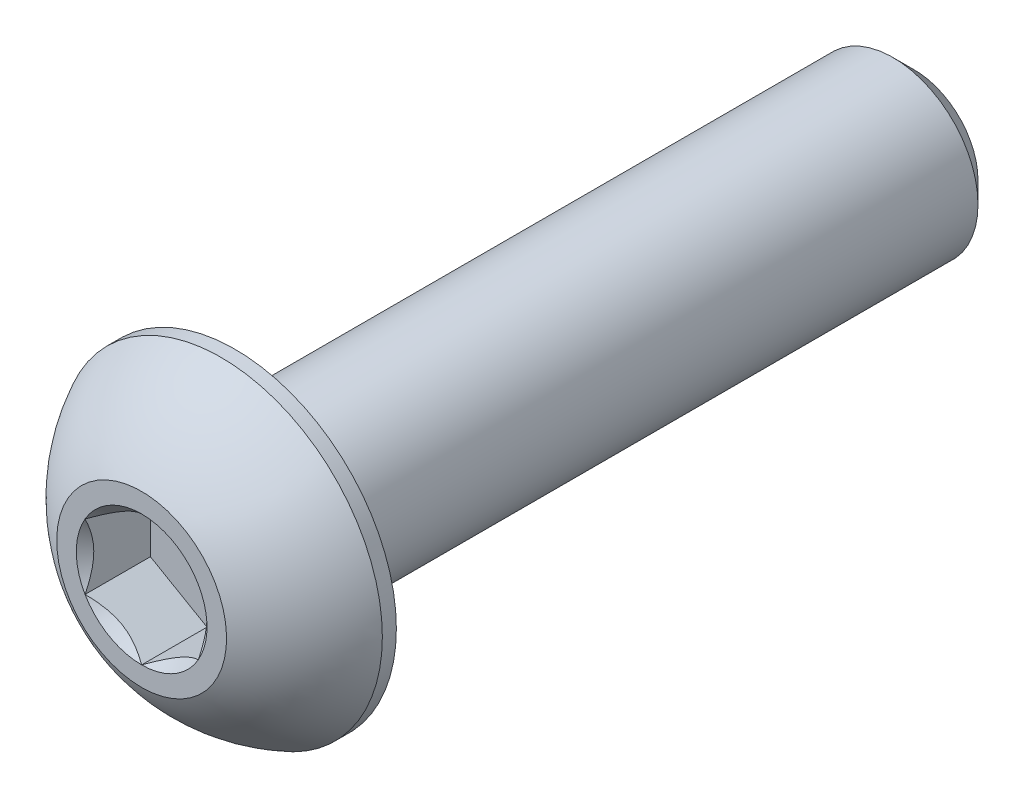
from build123d import *

# Parameters (mm, degrees)
CUT_EXTRUDE2_DEPTH = 1.155


with BuildPart() as part:
    # Sketch10 → Revolve3 (revolve)
    with BuildSketch(Plane(origin=(0, 0, 0), x_dir=(0, 0, -1), z_dir=(1, 0, 0)), mode=Mode.PRIVATE) as revolve3_sk:
        Polygon((13.275, 1.5), (13.65, 1.125), (13.65, 0), (1.65, 0), (1.65, 1.5), align=None)
    revolve(revolve3_sk.sketch.rotate(Axis((0, 0, 0), (0, 0, -1)), 90), axis=Axis((0, 0, 0), (0, 0, -1)))

    # Sketch7 → Revolve2 (revolve)
    with BuildSketch(Plane(origin=(0, 0, 0), x_dir=(0, 0, -1), z_dir=(1, 0, 0)), mode=Mode.PRIVATE) as revolve2_sk:
        with BuildLine():
            Line((1.4025, 2.85), (1.65, 2.85))
            Line((1.65, 2.85), (1.65, 0))
            Line((1.65, 0), (0, 0))
            Line((0, 0), (0, 1.5))
            ThreePointArc((0, 1.5), (0.59512511, 2.285251969), (1.4025, 2.85))
        make_face()
    revolve(revolve2_sk.sketch.rotate(Axis((0, 0, 0), (0, 0, -1)), 180), axis=Axis((0, 0, 0), (0, 0, -1)))

    # Sketch5 → Cut-Extrude2 (cut)
    with BuildSketch(Plane.XY):
        Polygon((1, -0.577350269), (1, 0.577350269), (0, 1.154700538), (-1, 0.577350269), (-1, -0.577350269), (0, -1.154700538), align=None)
    extrude(amount=-CUT_EXTRUDE2_DEPTH, mode=Mode.SUBTRACT)

    # Cut-Extrude3 cone 1 section (through the dimple's axis) → Cut-Extrude3 (revolve, cut)
    with BuildSketch(Plane(origin=(0, 0, 0), x_dir=(0, -1, 0), z_dir=(1, 0, 0))):
        Polygon((0, 0), (1.154700538, 0), (0, 1.154700538), align=None)
    revolve(axis=Axis((0, 0, 0), (0, 0, -1)), mode=Mode.SUBTRACT)


with BuildPart() as body_2:
    # Split1: read off the stored shape, not the designer's step
    # Split1: the piece on the far side of the plane
    add(part.part)
    split(bisect_by=Plane.XY.offset(-1.65), keep=Keep.BOTTOM)


with BuildPart() as part_1:
    add(part.part)

    # Split1
    split(bisect_by=Plane.XY.offset(-1.65), keep=Keep.TOP)


with BuildPart() as body_2_1:
    add(body_2.part)

    # Boss-Extrude1: read off the stored shape, not the designer's step
    # Boss-Extrude1: union part
    add(part_1.part)


solid = body_2_1.part
